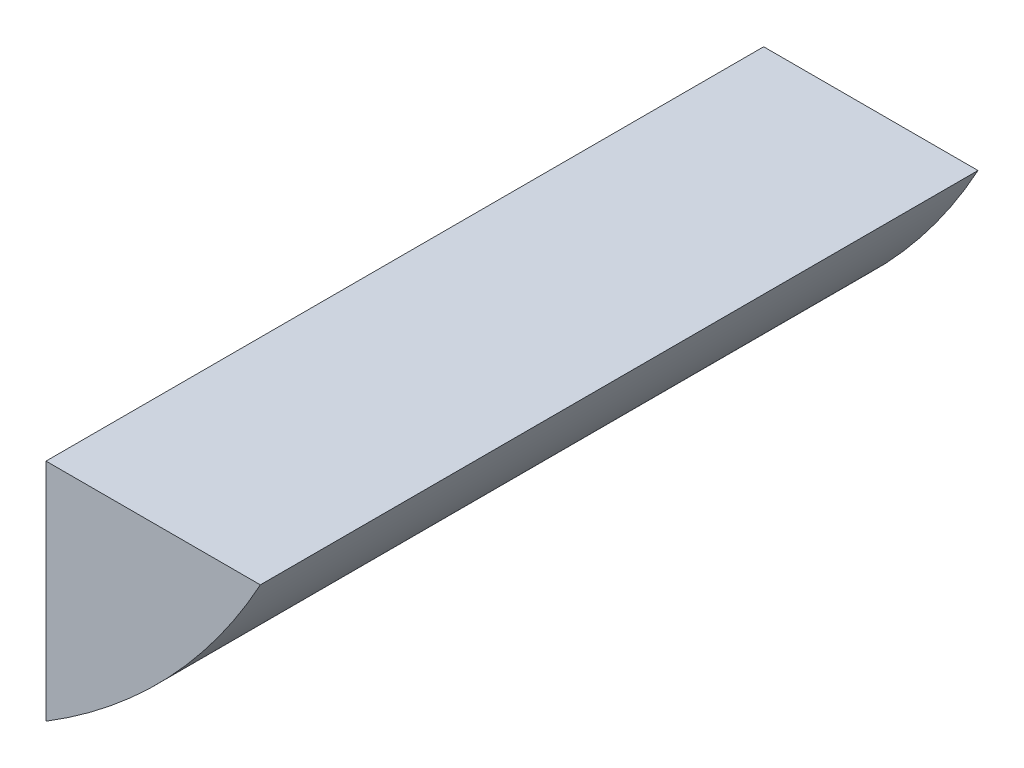
from build123d import *

# Parameters (mm, degrees)
DODANIE_WYCI_GNI_CIE1_DEPTH = 50


with BuildPart() as part:
    # Szkic1 → Dodanie-wyciągnięcie1 (new body)
    with BuildSketch(Plane.XY):
        with BuildLine():
            ThreePointArc((18.026405253, -34.879475269), (26.520137856, -28.007567099), (32.959582694, -19.181460051))
            Line((32.959582694, -19.181460051), (18.026405253, -19.181460051))
            Line((18.026405253, -19.181460051), (18.026405253, -34.879475269))
        make_face()
    extrude(amount=DODANIE_WYCI_GNI_CIE1_DEPTH)


solid = part.part
